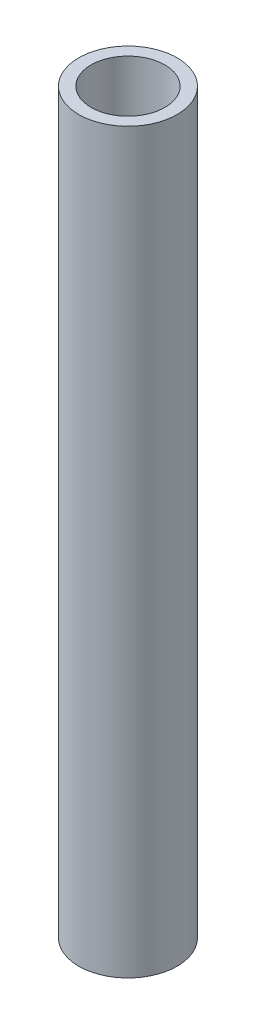
from build123d import *

# Parameters (mm, degrees)
SKETCH1_R           = 4
BOSS_EXTRUDE1_DEPTH = 60
SKETCH2_R           = 3
CUT_EXTRUDE1_DEPTH  = 36.454195802
CUT_EXTRUDE2_DEPTH  = 61.266076693
CUT_EXTRUDE3_REACH  = 62.266
SKETCH7_R           = 2.7


with BuildPart() as part:
    # Sketch1 → Boss-Extrude1 (new body)
    with BuildSketch(Plane(origin=(0, 0, 0), x_dir=(1, 0, 0), z_dir=(0, 1, 0))):
        Circle(SKETCH1_R)
    extrude(amount=BOSS_EXTRUDE1_DEPTH)

    # Sketch2 → Cut-Extrude1 (cut, through all)
    with BuildSketch(Plane(origin=(0, 25, 0), x_dir=(1, 0, 0), z_dir=(0, 1, 0))):
        Circle(SKETCH2_R)
    extrude(amount=CUT_EXTRUDE1_DEPTH, mode=Mode.SUBTRACT)

    # Sketch3 → Cut-Extrude2 (cut, through all)
    with BuildSketch(Plane(origin=(0, 0, 0), x_dir=(0, 0, -1), z_dir=(1, 0, 0))):
        with BuildLine():
            Line((-2.5, 27.5), (-2.5, 31))
            ThreePointArc((-2.5, 31), (0, 33.5), (2.5, 31))
            Line((2.5, 31), (2.5, 27.5))
            ThreePointArc((2.5, 27.5), (0, 25), (-2.5, 27.5))
        make_face()
    extrude(amount=-CUT_EXTRUDE2_DEPTH, mode=Mode.SUBTRACT)

    # Sketch7 → Cut-Extrude3 (cut, up to next)
    with BuildSketch(Plane(origin=(0, 0, 0), x_dir=(1, 0, 0), z_dir=(0, 1, 0)), mode=Mode.PRIVATE) as cut_extrude3_sk1:
        Circle(SKETCH7_R)
    cut_extrude3_tool1 = extrude(cut_extrude3_sk1.sketch, amount=CUT_EXTRUDE3_REACH, mode=Mode.PRIVATE) & part.part
    add(cut_extrude3_tool1.solids().sort_by_distance((0, 0, 0))[0], mode=Mode.SUBTRACT)


solid = part.part
